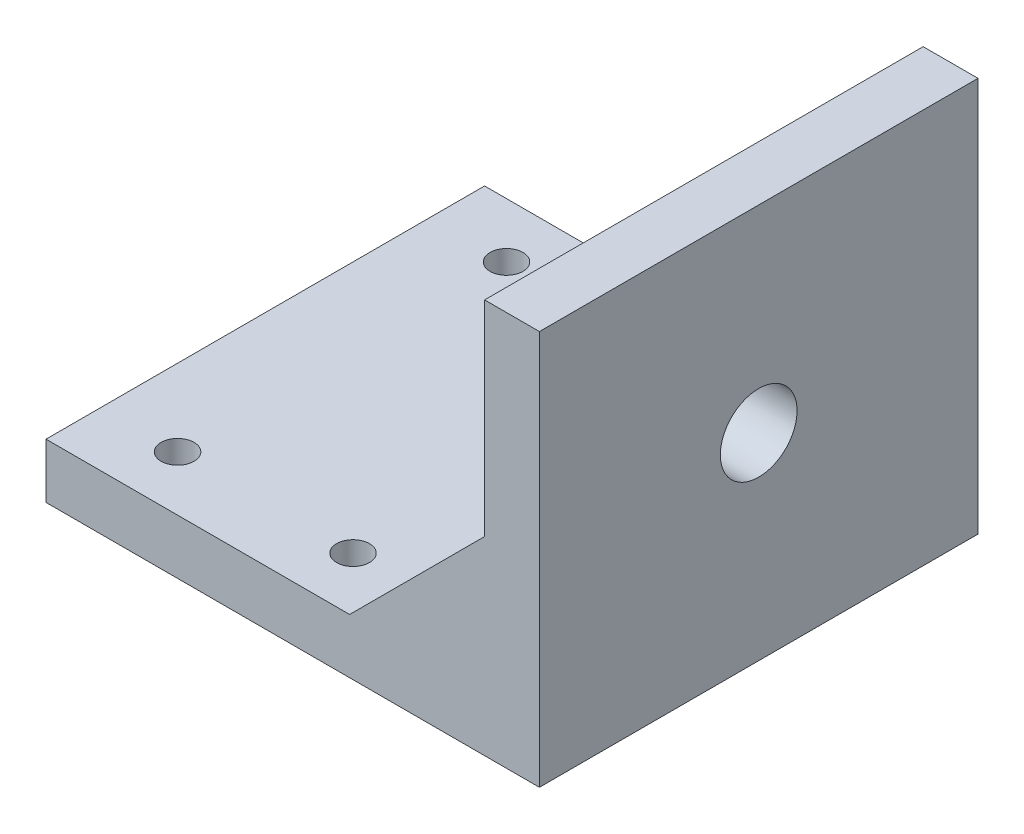
from build123d import *

# Parameters (mm, degrees)
SALIENTE_EXTRUIR1_DEPTH = 40
CROQUIS2_R              = 3.5
CORTAR_EXTRUIR1_DEPTH   = 70.234992809
SALIENTE_EXTRUIR2_DEPTH = 7
SALIENTE_EXTRUIR3_DEPTH = 7
CROQUIS5_R              = 1.5
CORTAR_EXTRUIR2_DEPTH   = 70.797428128


with BuildPart() as part:
    # Croquis1 → Saliente-Extruir1 (new body)
    with BuildSketch(Plane.XY):
        Polygon((0.551367026, 34.183098592), (0.551367026, -1.816901408), (-44.448632974, -1.816901408), (-44.448632974, 3.183098592), (-4.448632974, 3.183098592), (-4.448632974, 34.183098592), align=None)
    extrude(amount=SALIENTE_EXTRUIR1_DEPTH)

    # Croquis2 → Cortar-Extruir1 (cut, through all)
    with BuildSketch(Plane(origin=(0.551367026, 0, 0), x_dir=(0, 0, -1), z_dir=(1, 0, 0))):
        with Locations((-20, 16.183098592)):
            Circle(CROQUIS2_R)
    extrude(amount=-CORTAR_EXTRUIR1_DEPTH, mode=Mode.SUBTRACT)

    # Croquis3 → Saliente-Extruir2 (add)
    with BuildSketch(Plane.XY.offset(40)):
        Polygon((-4.448632974, 15.490973261), (-16.756507643, 3.183098592), (-4.448632974, 3.183098592), align=None)
    extrude(amount=-SALIENTE_EXTRUIR2_DEPTH)

    # Croquis4 → Saliente-Extruir3 (add)
    with BuildSketch(Plane(origin=(0, 0, 0), x_dir=(-1, 0, 0), z_dir=(0, 0, -1))):
        Polygon((4.448632974, 3.183098592), (16.756507643, 3.183098592), (4.448632974, 15.490973261), align=None)
    extrude(amount=-SALIENTE_EXTRUIR3_DEPTH)

    # Croquis5 → Cortar-Extruir2 (cut, through all)
    with BuildSketch(Plane.XZ.offset(1.816901408)):
        with Locations((-37.448632974, 35)):
            Circle(CROQUIS5_R)
        with Locations((-21.448632974, 35)):
            Circle(CROQUIS5_R)
        with Locations((-21.448632974, 5)):
            Circle(CROQUIS5_R)
        with Locations((-37.448632974, 5)):
            Circle(CROQUIS5_R)
    extrude(amount=-CORTAR_EXTRUIR2_DEPTH, mode=Mode.SUBTRACT)


solid = part.part
